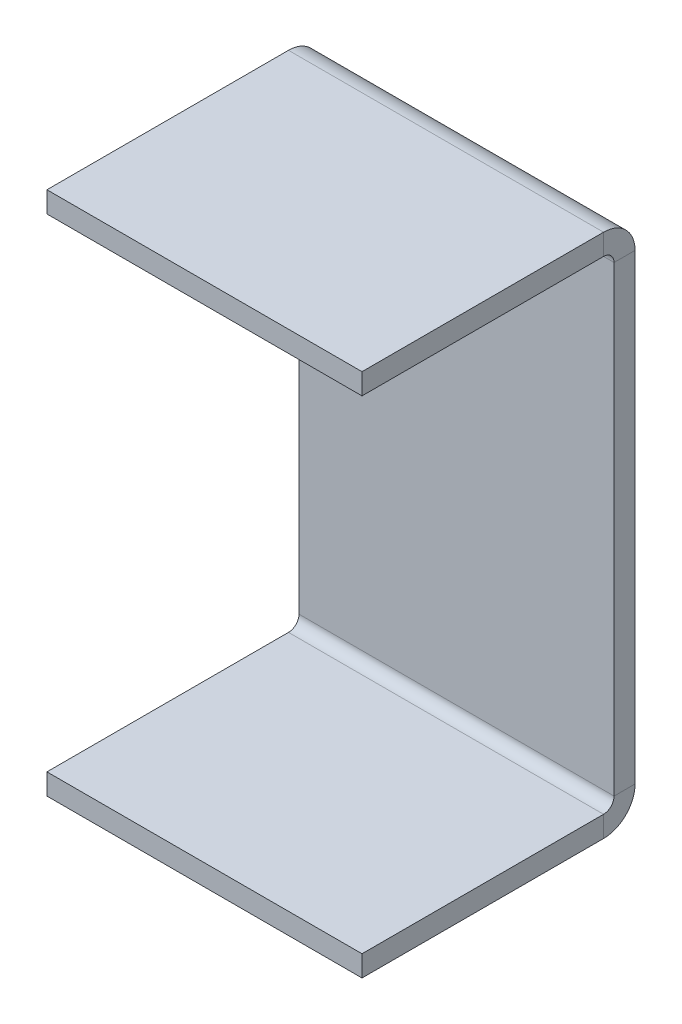
from build123d import *

# Parameters (mm, degrees)
SKETCH_1_W                         = 150
SKETCH_1_H                         = 250
SM_BASE_FLANGE_1_DEPTH             = 10
SM_EDGE_FLANGE_1_STRIP_W           = 50
SM_EDGE_FLANGE_1_STRIP_H           = 10
SM_EDGE_FLANGE_1_STRIP_CUT_DEPTH   = 150
SM_EDGE_FLANGE_1_STRIP_2_W         = 50
SM_EDGE_FLANGE_1_STRIP_2_H         = 10
SM_EDGE_FLANGE_1_STRIP_CUT_2_DEPTH = 150
SM_EDGE_FLANGE_1_DEPTH             = 150
SM_EDGE_FLANGE_1_BEND_DEPTH        = 150


# Sheet-metal steps are written as plain solids
with BuildPart() as part:
    # Sketch 1 → 基体-法兰1 (new body)
    with BuildSketch(Plane.XY):
        Rectangle(SKETCH_1_W, SKETCH_1_H)
    extrude(amount=-SM_BASE_FLANGE_1_DEPTH)

    # 边线-法兰1 strip (across the edge) → 边线-法兰1 strip cut (cut)
    with BuildSketch(Plane(origin=(75, 125, 0), x_dir=(0, -1, 0), z_dir=(-1, 0, 0))):
        with Locations((-10, -5)):
            Rectangle(SM_EDGE_FLANGE_1_STRIP_W, SM_EDGE_FLANGE_1_STRIP_H)
    extrude(amount=SM_EDGE_FLANGE_1_STRIP_CUT_DEPTH, mode=Mode.SUBTRACT)

    # 边线-法兰1 strip 2 (across the edge) → 边线-法兰1 strip cut 2 (cut)
    with BuildSketch(Plane(origin=(-75, -125, 0), x_dir=(0, 1, 0), z_dir=(1, 0, 0))):
        with Locations((-10, -5)):
            Rectangle(SM_EDGE_FLANGE_1_STRIP_2_W, SM_EDGE_FLANGE_1_STRIP_2_H)
    extrude(amount=SM_EDGE_FLANGE_1_STRIP_CUT_2_DEPTH, mode=Mode.SUBTRACT)

    # 边线-法兰1 section (across the edge) → 边线-法兰1 (add)
    with BuildSketch(Plane(origin=(75, 125, 0), x_dir=(0, -1, 0), z_dir=(-1, 0, 0))):
        with BuildLine():
            Line((0, 5), (0, 120))
            Line((0, 120), (10, 120))
            Line((10, 120), (10, 5))
            ThreePointArc((10, 5), (11.464466094, 1.464466094), (15, 0))
            Line((15, 0), (15, -10))
            ThreePointArc((15, -10), (4.393398282, -5.606601718), (0, 5))
        make_face()
    extrude(amount=SM_EDGE_FLANGE_1_DEPTH)

    # 边线-法兰1 section 2 (across the edge) → 边线-法兰1 bend (add)
    with BuildSketch(Plane(origin=(-75, -125, 0), x_dir=(0, 1, 0), z_dir=(1, 0, 0))):
        with BuildLine():
            Line((0, 5), (0, 120))
            Line((0, 120), (10, 120))
            Line((10, 120), (10, 5))
            ThreePointArc((10, 5), (11.464466094, 1.464466094), (15, 0))
            Line((15, 0), (15, -10))
            ThreePointArc((15, -10), (4.393398282, -5.606601718), (0, 5))
        make_face()
    extrude(amount=SM_EDGE_FLANGE_1_BEND_DEPTH)


solid = part.part
